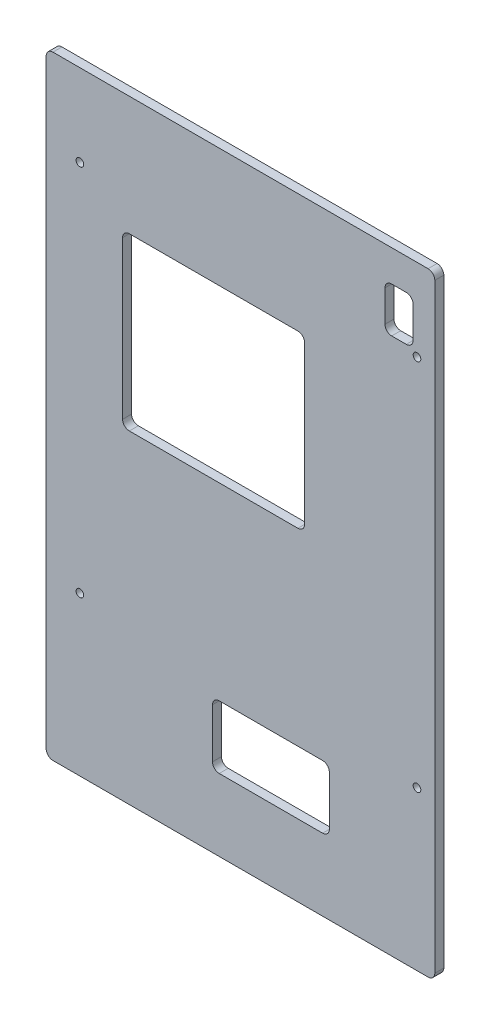
from build123d import *

# Parameters (mm, degrees)
ESQUISSE1_W        = 172.93
ESQUISSE1_H        = 273
ESQUISSE1_R        = 1.5
ESQUISSE1_W_2      = 52
ESQUISSE1_H_2      = 28
ESQUISSE1_W_3      = 81
ESQUISSE1_H_3      = 76
ESQUISSE1_W_4      = 12.5
ESQUISSE1_H_4      = 20
BOSS_EXTRU_1_DEPTH = 4
D_GAGEMENT_M31_D   = 3.4
CONG_1_R           = 3


with BuildPart() as part:
    # Esquisse1 → Boss.-Extru.1 (new body)
    with BuildSketch(Plane.XY):
        with Locations((86.465, 136.5)):
            Rectangle(ESQUISSE1_W, ESQUISSE1_H)
        with Locations((15, 236.5)):
            Circle(ESQUISSE1_R, mode=Mode.SUBTRACT)
        with Locations((165, 236.5)):
            Circle(ESQUISSE1_R, mode=Mode.SUBTRACT)
        with Locations((15, 70.5)):
            Circle(ESQUISSE1_R, mode=Mode.SUBTRACT)
        with Locations((165, 70.5)):
            Circle(ESQUISSE1_R, mode=Mode.SUBTRACT)
        with Locations((100, 46)):
            Rectangle(ESQUISSE1_W_2, ESQUISSE1_H_2, mode=Mode.SUBTRACT)
        with Locations((74.5, 182)):
            Rectangle(ESQUISSE1_W_3, ESQUISSE1_H_3, mode=Mode.SUBTRACT)
        with Locations((157, 249)):
            Rectangle(ESQUISSE1_W_4, ESQUISSE1_H_4, mode=Mode.SUBTRACT)
    extrude(amount=BOSS_EXTRU_1_DEPTH)

    # Dégagement M31 (through all)
    with Locations(Plane.XY.offset(4)):
        with Locations((15, 236.5), (15, 70.5), (165, 236.5), (165, 70.5)):
            Hole(D_GAGEMENT_M31_D / 2)

    # Congé1
    cong_1_edges = [part.edges().sort_by_distance(p)[0] for p in [
        (0, 0, 2),
        (172.93, 0, 2),
        (126, 32, 2),
        (74, 32, 2),
        (126, 60, 2),
        (74, 60, 2),
        (115, 144, 2),
        (34, 144, 2),
        (115, 220, 2),
        (34, 220, 2),
        (172.93, 273, 2),
        (0, 273, 2),
        (163.25, 239, 2),
        (163.25, 259, 2),
        (150.75, 259, 2),
        (150.75, 239, 2),
    ]]
    fillet(cong_1_edges, radius=CONG_1_R)


solid = part.part
